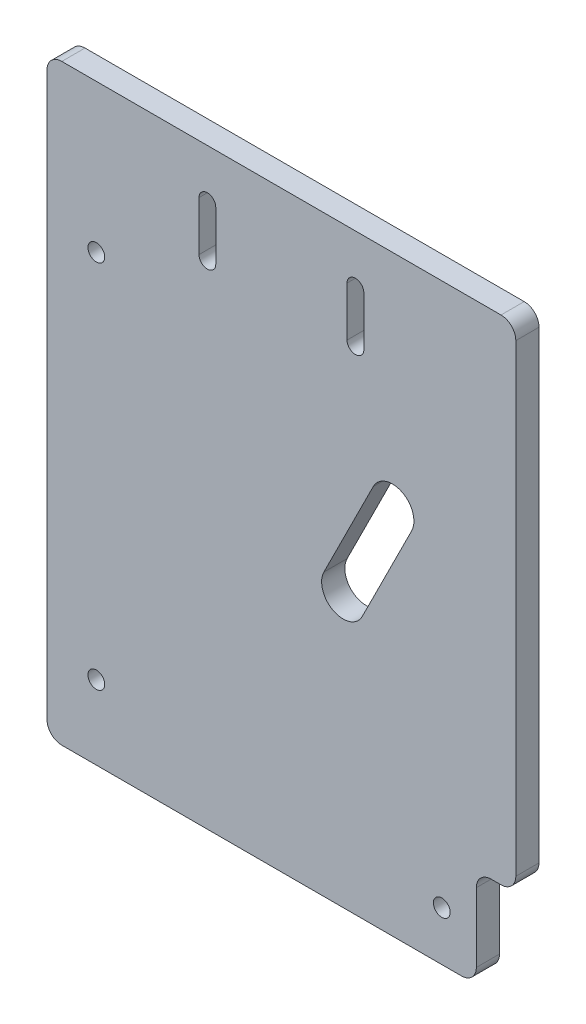
from build123d import *

# Parameters (mm, degrees)
SKETCH1_W           = 95
SKETCH1_H           = 120
SKETCH1_R           = 1.7
BOSS_EXTRUDE1_DEPTH = 4.7
FILLET1_R           = 3
CUT_EXTRUDE1_DEPTH  = 10
SKETCH3_W           = 8
SKETCH3_H           = 20
CUT_EXTRUDE2_DEPTH  = 154.12442653
FILLET2_R           = 3


with BuildPart() as part:
    # Sketch1 → Boss-Extrude1 (new body)
    with BuildSketch(Plane.XY):
        with Locations((47.5, -60)):
            Rectangle(SKETCH1_W, SKETCH1_H)
        with Locations((80, -110)):
            Circle(SKETCH1_R, mode=Mode.SUBTRACT)
        with BuildLine():
            Line((56.109241719, -63.05462086), (66.109241719, -43.05462086))
            ThreePointArc((66.109241719, -43.05462086), (71.94537914, -41.109241719), (73.890758281, -46.94537914))
            Line((73.890758281, -46.94537914), (63.890758281, -66.94537914))
            ThreePointArc((63.890758281, -66.94537914), (58.05462086, -68.890758281), (56.109241719, -63.05462086))
        make_face(mode=Mode.SUBTRACT)
        with Locations((10, -30)):
            Circle(SKETCH1_R, mode=Mode.SUBTRACT)
        with Locations((10, -105)):
            Circle(SKETCH1_R, mode=Mode.SUBTRACT)
    extrude(amount=BOSS_EXTRUDE1_DEPTH)

    # Fillet1
    fillet1_edges = [part.edges().sort_by_distance(p)[0] for p in [
        (95, -120, 2.35),
        (0, -120, 2.35),
        (95, 0, 2.35),
        (0, 0, 2.35),
    ]]
    fillet(fillet1_edges, radius=FILLET1_R)

    # Sketch2 → Cut-Extrude1 (cut)
    with BuildSketch(Plane.XY.offset(4.7)):
        with BuildLine():
            Line((30.8, -10), (30.8, -20))
            ThreePointArc((30.8, -20), (32.5, -21.7), (34.2, -20))
            Line((34.2, -20), (34.2, -10))
            ThreePointArc((34.2, -10), (32.5, -8.3), (30.8, -10))
        make_face()
        with BuildLine():
            Line((60.8, -10), (60.8, -20))
            ThreePointArc((60.8, -20), (62.5, -21.7), (64.2, -20))
            Line((64.2, -20), (64.2, -10))
            ThreePointArc((64.2, -10), (62.5, -8.3), (60.8, -10))
        make_face()
    extrude(amount=-CUT_EXTRUDE1_DEPTH, mode=Mode.SUBTRACT)

    # Sketch3 → Cut-Extrude2 (cut, through all)
    with BuildSketch(Plane.XY.offset(4.7)):
        with Locations((91, -110)):
            Rectangle(SKETCH3_W, SKETCH3_H)
    extrude(amount=-CUT_EXTRUDE2_DEPTH, mode=Mode.SUBTRACT)

    # Fillet2
    fillet2_edges = [part.edges().sort_by_distance(p)[0] for p in [
        (87, -120, 2.35),
        (87, -100, 2.35),
        (95, -100, 2.35),
    ]]
    fillet(fillet2_edges, radius=FILLET2_R)


solid = part.part
